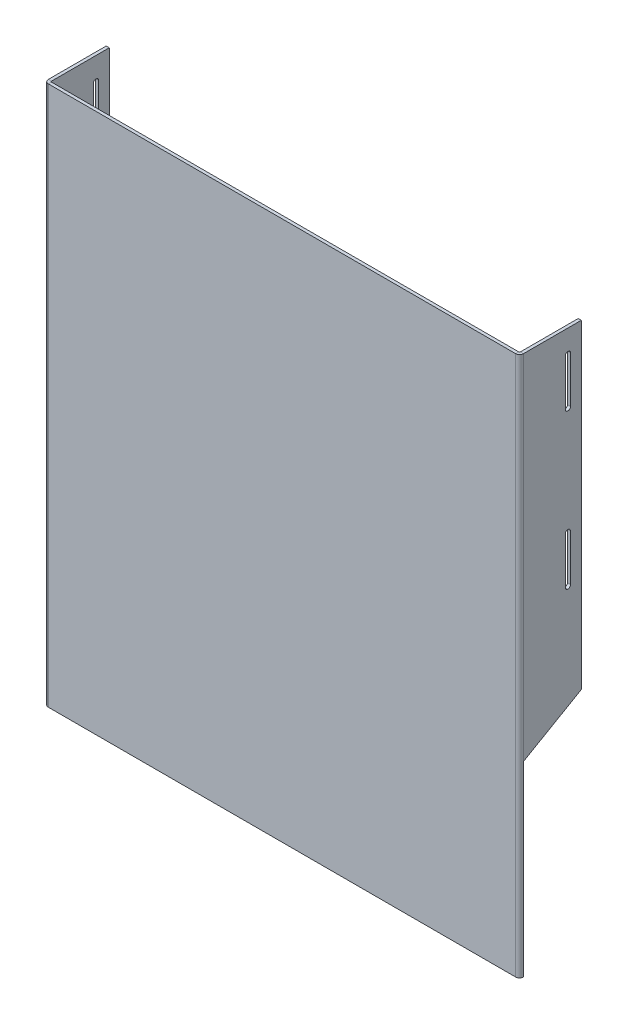
from build123d import *

# Parameters (mm, degrees)
SKETCH1_W            = 303
SKETCH1_H            = 350
BASE_FLANGE1_DEPTH   = 2
EDGE_FLANGE1_DEPTH   = 350
CUT_EXTRUDE1_REACH   = 468.294
CUT_EXTRUDE2_REACH   = 468.294
LPATTERN1_COUNT      = 2
LPATTERN1_PITCH      = 100
MIRROR1_COPY_1_REACH = 468.294


# Sheet-metal steps are written as plain solids
with BuildPart() as part:
    # Sketch1 → Base-Flange1 (new body)
    with BuildSketch(Plane.XY):
        with Locations((-151.5, 175)):
            Rectangle(SKETCH1_W, SKETCH1_H)
    extrude(amount=-BASE_FLANGE1_DEPTH)

    # Edge-Flange1 section (across the edge) → Edge-Flange1 (add)
    with BuildSketch(Plane(origin=(-303.5, 0, -2), x_dir=(1, 0, 0), z_dir=(0, 1, 0))):
        with BuildLine():
            Line((-2, 0.5), (-2, 38))
            Line((-2, 38), (0, 38))
            Line((0, 38), (0, 0.5))
            ThreePointArc((0, 0.5), (0.146446609, 0.146446609), (0.5, 0))
            Line((0.5, 0), (0.5, -2))
            ThreePointArc((0.5, -2), (-1.267766953, -1.267766953), (-2, 0.5))
        make_face()
    edge_flange1 = extrude(amount=EDGE_FLANGE1_DEPTH)

    # Sketch15 → Cut-Extrude1 (cut, up to next)
    with BuildSketch(Plane.ZY.offset(305.5), mode=Mode.PRIVATE) as cut_extrude1_sk1:
        Polygon((-2.5, 0), (-2.5, 121), (-40, 142.650635095), (-40, 0), align=None)
    cut_extrude1_tool1 = extrude(cut_extrude1_sk1.sketch, amount=-CUT_EXTRUDE1_REACH, mode=Mode.PRIVATE) & part.part
    cut_extrude1 = cut_extrude1_tool1.solids().sort_by_distance((-305.5, 66.060819, -21.763242))[0]
    add(cut_extrude1, mode=Mode.SUBTRACT)

    # Sketch18 → Cut-Extrude2 (cut, up to next)
    with BuildSketch(Plane.ZY.offset(305.5), mode=Mode.PRIVATE) as cut_extrude2_sk1:
        with BuildLine():
            Line((-29.6559, 235.1372), (-29.6559, 205.1372))
            ThreePointArc((-29.6559, 205.1372), (-31.3559, 203.4372), (-33.0559, 205.1372))
            Line((-33.0559, 205.1372), (-33.0559, 235.1372))
            ThreePointArc((-33.0559, 235.1372), (-31.3559, 236.8372), (-29.6559, 235.1372))
        make_face()
    cut_extrude2_tool1 = extrude(cut_extrude2_sk1.sketch, amount=-CUT_EXTRUDE2_REACH, mode=Mode.PRIVATE) & part.part
    cut_extrude2 = cut_extrude2_tool1.solids().sort_by_distance((-305.5, 220.1372, -31.3559))[0]
    add(cut_extrude2, mode=Mode.SUBTRACT)

    # LPattern1: Cut-Extrude2 ×2
    with Locations(*[(0, i * LPATTERN1_PITCH, 0) for i in range(1, LPATTERN1_COUNT)]):
        add(cut_extrude2, mode=Mode.SUBTRACT)

    # Mirror1: Edge-Flange1, Cut-Extrude1, Cut-Extrude2 across plane
    add(edge_flange1.mirror(Plane.ZY.offset(151.5)))
    add(cut_extrude1.mirror(Plane.ZY.offset(151.5)), mode=Mode.SUBTRACT)
    add(cut_extrude2.mirror(Plane.ZY.offset(151.5)), mode=Mode.SUBTRACT)

    # Mirror1 copy 1 sketch → Mirror1 copy 1 (cut, up to next)
    with BuildSketch(Plane(origin=(2.5, 100, 0), x_dir=(0, 0, 1), z_dir=(1, 0, 0)), mode=Mode.PRIVATE) as mirror1_copy_1_sk1:
        with BuildLine():
            Line((-29.6559, -235.1372), (-29.6559, -205.1372))
            ThreePointArc((-29.6559, -205.1372), (-31.3559, -203.4372), (-33.0559, -205.1372))
            Line((-33.0559, -205.1372), (-33.0559, -235.1372))
            ThreePointArc((-33.0559, -235.1372), (-31.3559, -236.8372), (-29.6559, -235.1372))
        make_face()
    mirror1_copy_1_tool1 = extrude(mirror1_copy_1_sk1.sketch, amount=-MIRROR1_COPY_1_REACH, mode=Mode.PRIVATE) & part.part
    add(mirror1_copy_1_tool1.solids().sort_by_distance((2.5, 320.1372, -31.3559))[0], mode=Mode.SUBTRACT)


solid = part.part
